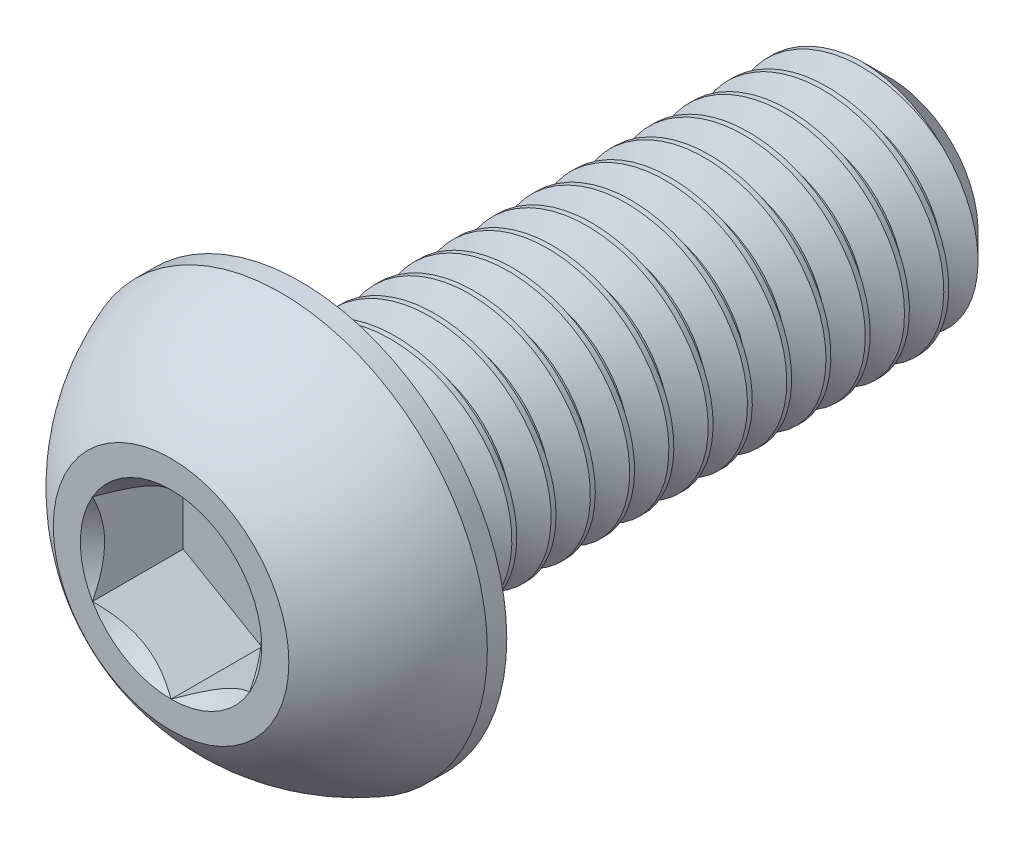
from build123d import *

# Parameters (mm, degrees)
SKETCH1_W          = 15
SKETCH1_H          = 3
CHAMFER1_SIZE      = 0.75
CUT_EXTRUDE2_DEPTH = 2.31
CUT_SWEEP1_PITCH   = 1


with BuildPart() as part:
    # Sketch1 → Revolve1 (revolve)
    with BuildSketch(Plane(origin=(0, 0, 0), x_dir=(0, 0, -1), z_dir=(1, 0, 0)), mode=Mode.PRIVATE) as revolve1_sk:
        with Locations((10.8, 1.5)):
            Rectangle(SKETCH1_W, SKETCH1_H)
    revolve(revolve1_sk.sketch.rotate(Axis((0, 0, -18.3), (0, 0, 1)), 90), axis=Axis((0, 0, -18.3), (0, 0, 1)))

    # Chamfer1
    chamfer1_edges = [part.edges().sort_by_distance(p)[0] for p in [
        (3, 0, -18.3),
    ]]
    chamfer(chamfer1_edges, length=CHAMFER1_SIZE)

    # Sketch7 → Revolve2 (revolve)
    with BuildSketch(Plane(origin=(0, 0, 0), x_dir=(0, 0, -1), z_dir=(1, 0, 0)), mode=Mode.PRIVATE) as revolve2_sk:
        with BuildLine():
            Line((2.805, 5.25), (3.3, 5.25))
            Line((3.3, 5.25), (3.3, 0))
            Line((3.3, 0), (0, 0))
            Line((0, 0), (0, 3))
            ThreePointArc((0, 3), (1.216479019, 4.356906156), (2.805, 5.25))
        make_face()
    revolve(revolve2_sk.sketch.rotate(Axis((0, 0, 0), (0, 0, -1)), 180), axis=Axis((0, 0, 0), (0, 0, -1)))

    # Sketch5 → Cut-Extrude2 (cut)
    with BuildSketch(Plane.XY):
        Polygon((2, -1.154700538), (2, 1.154700538), (0, 2.309401077), (-2, 1.154700538), (-2, -1.154700538), (0, -2.309401077), align=None)
    extrude(amount=-CUT_EXTRUDE2_DEPTH, mode=Mode.SUBTRACT)

    # Cut-Extrude3 cone 1 section (through the dimple's axis) → Cut-Extrude3 (revolve, cut)
    with BuildSketch(Plane(origin=(0, 0, 0), x_dir=(0, -1, 0), z_dir=(1, 0, 0))):
        Polygon((0, 0), (2.309401077, 0), (0, 2.309401077), align=None)
    revolve(axis=Axis((0, 0, 0), (0, 0, -1)), mode=Mode.SUBTRACT)

    # Cut-Sweep1: the profile of Sketch2 profile screwed along a right-hand helix of 16 turns, 8 arcs to a turn; built about Z, then put on its axis
    cut_sweep1_z = Axis((0, 0, 0), (0, 0, 1))
    cut_sweep1_corners = [(3.0003, 0, 0.750173205), (3.0003, 0, -0.125173205), (2.350480947, 0, 0.25), (2.350480947, 0, 0.375)]
    with BuildLine(mode=Mode.PRIVATE) as cut_sweep1_profile:
        Line(cut_sweep1_corners[0], cut_sweep1_corners[1])
        Line(cut_sweep1_corners[1], cut_sweep1_corners[2])
        Line(cut_sweep1_corners[2], cut_sweep1_corners[3])
        Line(cut_sweep1_corners[3], cut_sweep1_corners[0])
    cut_sweep1_cap = Face(cut_sweep1_profile.wire())
    cut_sweep1_turn_angles = [0, 22.5, 45, 67.5, 90, 112.5, 135, 157.5, 180, 202.5, 225, 247.5, 270, 292.5, 315, 337.5, 360]
    cut_sweep1_turn_weights = [1, 0.9238795325112867, 1, 0.9238795325112867, 1, 0.9238795325112867, 1, 0.9238795325112867, 1, 0.9238795325112867, 1, 0.9238795325112867, 1, 0.9238795325112867, 1, 0.9238795325112867, 1]
    cut_sweep1_turn_rails = [Edge.make_bspline([Vector(p[0], p[1], 0).rotate(cut_sweep1_z, cut_sweep1_turn_angles[k]) / cut_sweep1_turn_weights[k] + Vector(0, 0, p[2] + CUT_SWEEP1_PITCH * cut_sweep1_turn_angles[k] / 360) for k in range(17)], [0, 0, 0, 1, 1, 2, 2, 3, 3, 4, 4, 5, 5, 6, 6, 7, 7, 8, 8, 8], 2, cut_sweep1_turn_weights) for p in cut_sweep1_corners]
    cut_sweep1_turn_sides = [Face.make_surface_from_curves(cut_sweep1_turn_rails[p[0]], cut_sweep1_turn_rails[p[1]]) for p in [(0, 1), (1, 2), (2, 3), (3, 0)]]
    cut_sweep1 = Plane(origin=(0, 0, -18.3), x_dir=(0, 1, 0), z_dir=(0, 0, 1)) * Solid(Shell([*[p.moved(Location((0, 0, CUT_SWEEP1_PITCH * i))) for i in range(16) for p in cut_sweep1_turn_sides], cut_sweep1_cap, cut_sweep1_cap.rotate(cut_sweep1_z, 5760).moved(Location((0, 0, CUT_SWEEP1_PITCH * 5760 / 360)))]))
    add(cut_sweep1, mode=Mode.SUBTRACT)


solid = part.part
